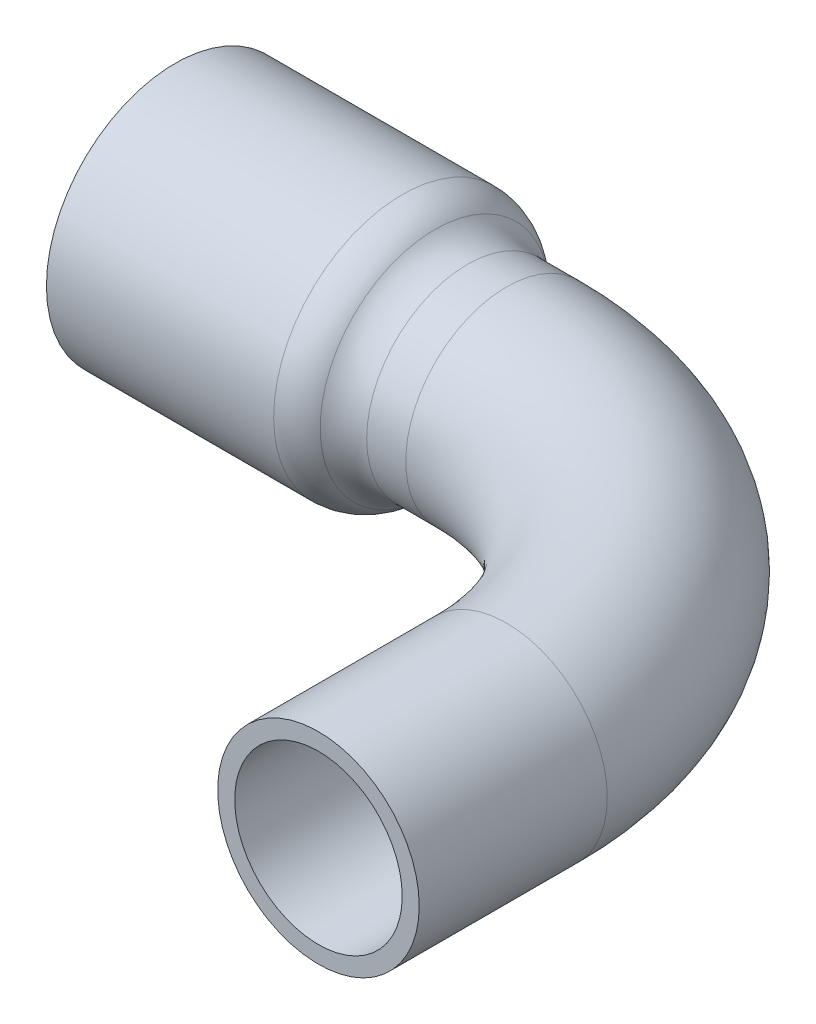
from build123d import *

# Parameters (mm, degrees)
SKETCH3_R           = 5.715
BOSS_EXTRUDE1_DEPTH = 10.668
SWEEP1_OUTLINE_R    = 5.715
SWEEP1_ANGLE        = 90
SKETCH9_R           = 5.715
BOSS_EXTRUDE2_DEPTH = 4.572
SKETCH11_R          = 7.3025
BOSS_EXTRUDE3_DEPTH = 14.224
FILLET1_R           = 2.54
FILLET2_R           = 2.54
SKETCH12_R          = 4.7498
CUT_EXTRUDE1_DEPTH  = 10.668
SKETCH13_R          = 6.35
CUT_EXTRUDE2_DEPTH  = 10.668


# Read off the part's stored shape, not the designer's step: Sweep1
with BuildPart() as part:
    # Sketch3 → Boss-Extrude1 (new body)
    with BuildSketch(Plane.XY):
        Circle(SKETCH3_R)
    extrude(amount=BOSS_EXTRUDE1_DEPTH)

    # Sweep1 outline → Sweep1 (revolve)
    with BuildSketch(Plane(origin=(-16.51, 0, 0), x_dir=(1, 0, 0), z_dir=(0, 0, 1))):
        with Locations((16.51, 0)):
            Circle(SWEEP1_OUTLINE_R)
    revolve(axis=Axis((-16.51, 0, 0), (0, 1, 0)), revolution_arc=SWEEP1_ANGLE)

    # Sketch9 → Boss-Extrude2 (add)
    with BuildSketch(Plane.ZY.offset(16.51)):
        with Locations(Location((-16.51, 0, 0), (0, 0, 180))):
            Circle(SKETCH9_R)
    extrude(amount=BOSS_EXTRUDE2_DEPTH)

    # Sketch11 → Boss-Extrude3 (add)
    with BuildSketch(Plane.ZY.offset(21.082)):
        with Locations((-16.51, 0)):
            Circle(SKETCH11_R)
    extrude(amount=BOSS_EXTRUDE3_DEPTH)

    # Fillet1
    # the kernel refuses this fillet: 2.54 mm, written as the material it adds along each edge
    with BuildSketch(Plane(origin=(-21.082, 0, -16.51), x_dir=(0, 0, -1), z_dir=(0, 1, 0))) as fillet1_piece_1:
        with BuildLine():
            CenterArc((8.255, -2.35464302), FILLET1_R, 112.024312837, 67.975687163)
            Line((5.715, -2.35464302), (5.6642, -2.35464302))
            Line((5.6642, -2.35464302), (5.6642, 0))
            Line((5.6642, 0), (5.715, 0.0508))
            ThreePointArc((5.715, 0.0508), (6.50875, 0.0508), (7.28345, 0.04709286))
            Line((7.28345, 0.04709286), (7.3025, 0))
        make_face()
    revolve(axis=Axis((-21.082, 0, -16.51), (-1, 0, 0)))

    # Fillet2
    fillet2_edges = [part.edges().sort_by_distance(p)[0] for p in [
        (-21.082, 7.3025, -16.51),
    ]]
    fillet(fillet2_edges, radius=FILLET2_R)

    # Sketch12 → Cut-Extrude1 (cut)
    with BuildSketch(Plane.XY.offset(10.668)):
        Circle(SKETCH12_R)
    extrude(amount=-CUT_EXTRUDE1_DEPTH, mode=Mode.SUBTRACT)

    # Sketch13 → Cut-Extrude2 (cut)
    with BuildSketch(Plane.ZY.offset(35.306)):
        with Locations((-16.51, 0)):
            Circle(SKETCH13_R)
    extrude(amount=-CUT_EXTRUDE2_DEPTH, mode=Mode.SUBTRACT)


solid = part.part
